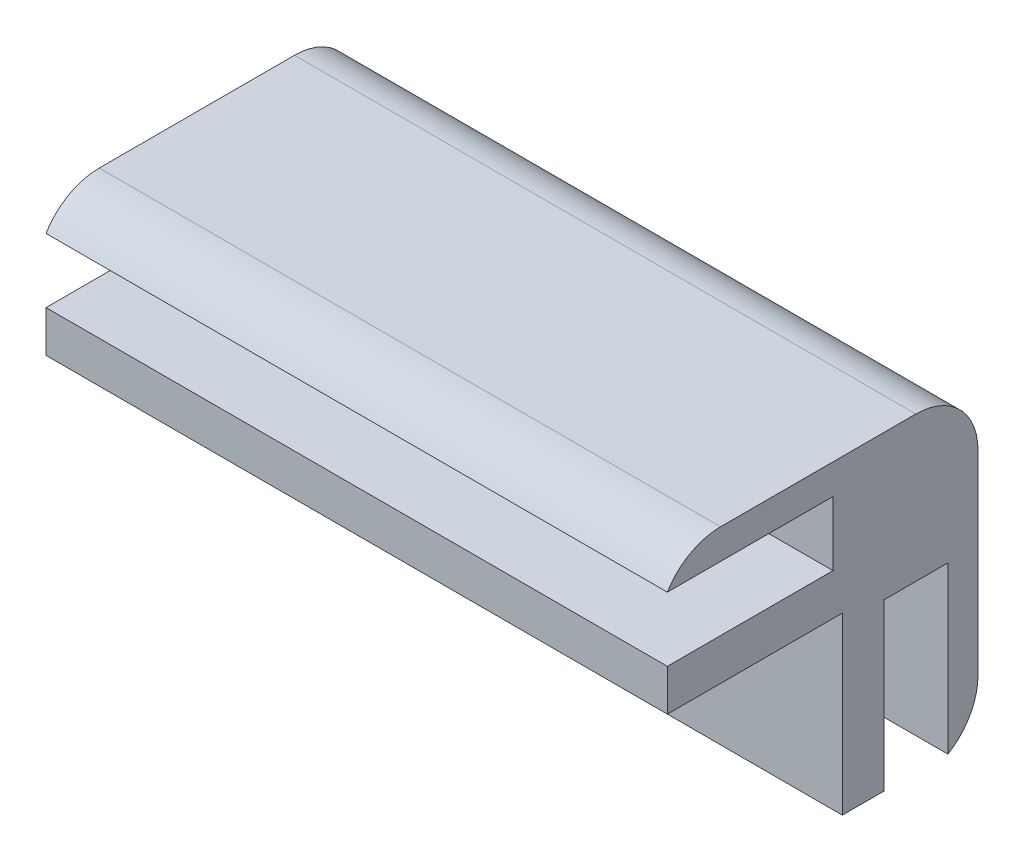
from build123d import *

# Parameters (mm, degrees)
SKETCH1_W               = 30
SKETCH1_H               = 15
BOSS_EXTRUDE1_DEPTH     = 15
CUT_EXTRUDE1_DEPTH      = 1.55
CUT_EXTRUDE1_DEPTH_BACK = 1.55
SKETCH2_W               = 30
SKETCH2_H               = 8
CUT_EXTRUDE2_DEPTH      = 1.55
CUT_EXTRUDE2_DEPTH_BACK = 1.55
SKETCH4_W               = 30
SKETCH4_H               = 8
SKETCH5_W               = 8.45
SKETCH5_H               = 8.45
CUT_EXTRUDE3_DEPTH      = 35.431000961
FILLET1_R               = 3


with BuildPart() as part:
    # Sketch1 → Boss-Extrude1 (new body)
    with BuildSketch(Plane(origin=(0, 0, 0), x_dir=(1, 0, 0), z_dir=(0, 1, 0))):
        with Locations((-19.236111111, 0.277777778)):
            Rectangle(SKETCH1_W, SKETCH1_H)
    extrude(amount=BOSS_EXTRUDE1_DEPTH)

    # Sketch2 → Cut-Extrude1 (cut, two sides: drawn at the far end of the back side and taken through both)
    with BuildSketch(Plane(origin=(0, 0, -4.777777778), x_dir=(-1, 0, 0), z_dir=(0, 0, -1)).offset(-CUT_EXTRUDE1_DEPTH_BACK)):
        with Locations((19.236111111, 4)):
            Rectangle(SKETCH2_W, SKETCH2_H)
    extrude(amount=CUT_EXTRUDE1_DEPTH + CUT_EXTRUDE1_DEPTH_BACK, mode=Mode.SUBTRACT)

    # Sketch4 → Cut-Extrude2 (cut, two sides: drawn at the far end of the back side and taken through both)
    with BuildSketch(Plane(origin=(0, 12, 0), x_dir=(1, 0, 0), z_dir=(0, 1, 0)).offset(-CUT_EXTRUDE2_DEPTH_BACK)):
        with Locations((-19.236111111, -3.222222222)):
            Rectangle(SKETCH4_W, SKETCH4_H)
    extrude(amount=CUT_EXTRUDE2_DEPTH + CUT_EXTRUDE2_DEPTH_BACK, mode=Mode.SUBTRACT)

    # Sketch5 → Cut-Extrude3 (cut, through all)
    with BuildSketch(Plane.ZY.offset(34.236111111)):
        with Locations((2.997222222, 4.225)):
            Rectangle(SKETCH5_W, SKETCH5_H)
    extrude(amount=-CUT_EXTRUDE3_DEPTH, mode=Mode.SUBTRACT)

    # Fillet1
    # the kernel refuses this fillet: 3 mm, written as the material it takes off along each edge
    with BuildSketch(Plane(origin=(2.185288658, 15, 7.222222222), x_dir=(0, 0, -1), z_dir=(-1, 0, 0)), Plane(origin=(-40.657510881, 0, -7.777777778), x_dir=(0, 1, 0), z_dir=(1, 0, 0))) as fillet1_piece_1:
        with BuildLine():
            CenterArc((2.568559908, 3), FILLET1_R, 211.108922511, 58.891077489)
            Line((0, 1.45), (-0.051371198, 1.419))
            ThreePointArc((-0.051371198, 1.419), (-0.06, 0.725), (-0.06, 0))
            Line((-0.06, 0), (0, -0.06))
            Line((0, -0.06), (2.568559908, -0.06))
            Line((2.568559908, -0.06), (2.568559908, 0))
        make_face()
    extrude(amount=42.842799539, mode=Mode.SUBTRACT)
    with BuildSketch(Plane(origin=(-41.736111111, 15, -7.777777778), x_dir=(0, -1, 0), z_dir=(1, 0, 0))) as fillet1_piece_2:
        with BuildLine():
            CenterArc((FILLET1_R, -FILLET1_R), FILLET1_R, 90, 90)
            Line((0, -FILLET1_R), (-FILLET1_R * 0.02, -FILLET1_R))
            Line((-FILLET1_R * 0.02, -FILLET1_R), (-FILLET1_R * 0.02, FILLET1_R * 0.02))
            Line((-FILLET1_R * 0.02, FILLET1_R * 0.02), (FILLET1_R, FILLET1_R * 0.02))
            Line((FILLET1_R, FILLET1_R * 0.02), (FILLET1_R, 0))
        make_face()
    extrude(amount=45, mode=Mode.SUBTRACT)


solid = part.part
